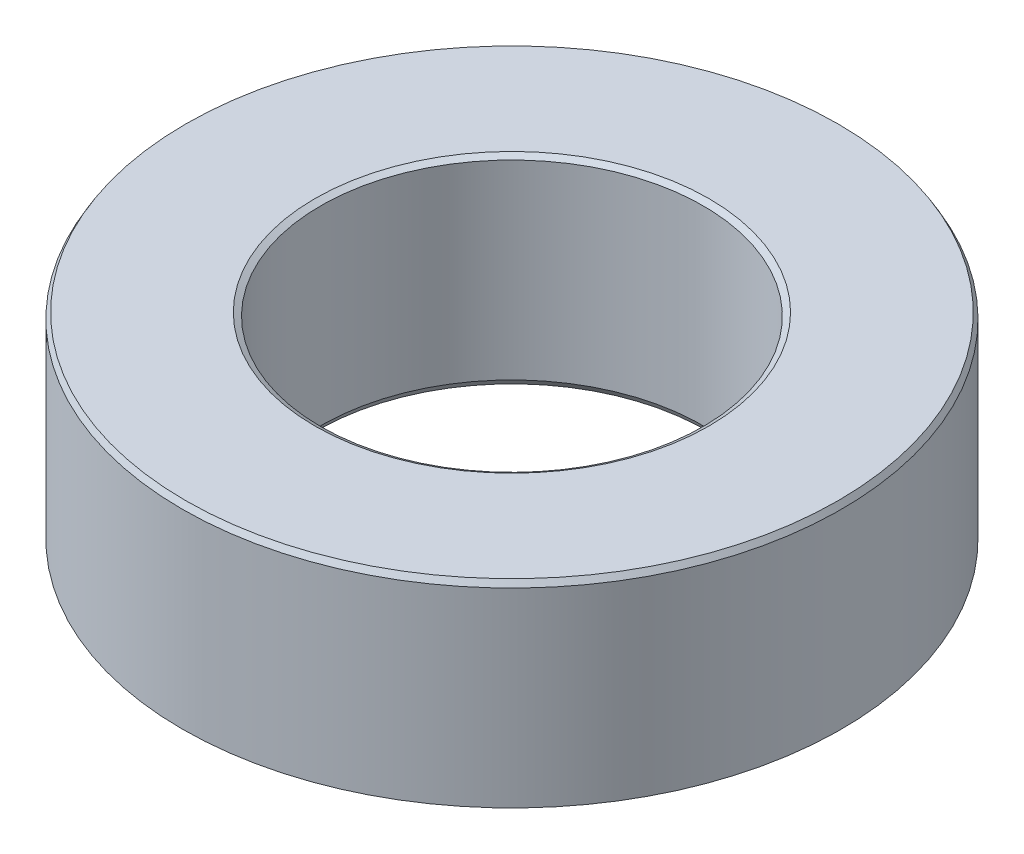
from build123d import *
from OCP.BRepFilletAPI import BRepFilletAPI_MakeChamfer

# Parameters (mm, degrees)
SKETCH1_R           = 50
BOSS_EXTRUDE1_DEPTH = 30.276937968
SKETCH2_R           = 29.015559674
CUT_EXTRUDE1_DEPTH  = 77.920042724
CHAMFER1_SIZE       = 0.87640097
CHAMFER1_SIZE2      = 0.505990336


with BuildPart() as part:
    # Sketch1 → Boss-Extrude1 (new body)
    with BuildSketch(Plane(origin=(0, 0, 0), x_dir=(1, 0, 0), z_dir=(0, 1, 0))):
        Circle(SKETCH1_R)
    extrude(amount=BOSS_EXTRUDE1_DEPTH)

    # Sketch2 → Cut-Extrude1 (cut, through all)
    with BuildSketch(Plane(origin=(0, 0, 0), x_dir=(1, 0, 0), z_dir=(0, 1, 0))):
        Circle(SKETCH2_R)
    extrude(amount=CUT_EXTRUDE1_DEPTH, mode=Mode.SUBTRACT)

    # Chamfer1: one chamfer whose edges measure the first distance from different faces: ONE call of the kernel's chamfer builder (chamfer() names one face for all edges)
    chamfer1_edges_1 = [part.edges().sort_by_distance(p)[0] for p in [
        (-29.015559674, 30.276937968, 0),
    ]]
    chamfer1_side_1 = [part.faces().sort_by_distance(p)[0] for p in [
        (-48.585786438, 30.276937968, 0),
    ]]
    chamfer1_edges_2 = [part.edges().sort_by_distance(p)[0] for p in [
        (-29.015559674, 0, 0),
    ]]
    chamfer1_side_2 = [part.faces().sort_by_distance(p)[0] for p in [
        (-29.015559674, 15.138468984, 0),
    ]]
    chamfer1_edges_3 = [part.edges().sort_by_distance(p)[0] for p in [
        (-50, 0, 0),
    ]]
    chamfer1_side_3 = [part.faces().sort_by_distance(p)[0] for p in [
        (-48.585786438, 0, 0),
    ]]
    chamfer1_edges_4 = [part.edges().sort_by_distance(p)[0] for p in [
        (-50, 30.276937968, 0),
    ]]
    chamfer1_side_4 = [part.faces().sort_by_distance(p)[0] for p in [
        (-50, 15.138468984, 0),
    ]]
    chamfer1 = BRepFilletAPI_MakeChamfer(part.part.solid().wrapped)
    for e in chamfer1_edges_1:
        chamfer1.Add(CHAMFER1_SIZE, CHAMFER1_SIZE2, e.wrapped, chamfer1_side_1[0].wrapped)  # the first distance lies on this face
    for e in chamfer1_edges_2:
        chamfer1.Add(CHAMFER1_SIZE, CHAMFER1_SIZE2, e.wrapped, chamfer1_side_2[0].wrapped)  # the first distance lies on this face
    for e in chamfer1_edges_3:
        chamfer1.Add(CHAMFER1_SIZE, CHAMFER1_SIZE2, e.wrapped, chamfer1_side_3[0].wrapped)  # the first distance lies on this face
    for e in chamfer1_edges_4:
        chamfer1.Add(CHAMFER1_SIZE, CHAMFER1_SIZE2, e.wrapped, chamfer1_side_4[0].wrapped)  # the first distance lies on this face
    add(Compound.cast(chamfer1.Shape()), mode=Mode.REPLACE)


solid = part.part
